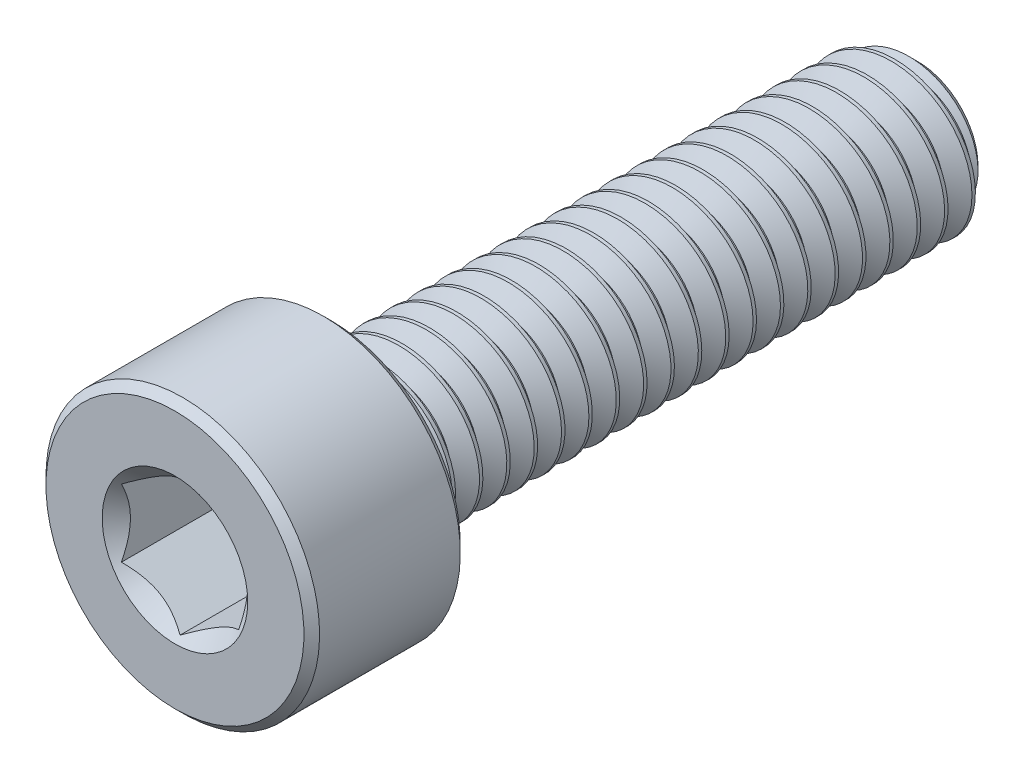
from build123d import *

# Parameters (mm, degrees)
CUT_EXTRUDE1_DEPTH     = 3
SPLIT1_SURFACE_1_BACK  = 22.424
SPLIT1_SURFACE_1_DEPTH = 44.848
SPLIT1_SURFACE_2_BACK  = 22.424
SPLIT1_SURFACE_2_DEPTH = 44.848
CUT_SWEEP1_PITCH       = 0.7


with BuildPart() as part:
    # Sketch2 → Revolve1 (revolve)
    with BuildSketch(Plane(origin=(0, 0, 0), x_dir=(0, 0, -1), z_dir=(1, 0, 0))):
        with BuildLine():
            Line((-9.5, 0), (-9.5, 3.3))
            Line((-9.5, 3.3), (-9.3, 3.5))
            Line((-9.3, 3.5), (-5.7, 3.5))
            Line((-5.7, 3.5), (-5.5, 3.3))
            Line((-5.5, 3.3), (-5.5, 2.2))
            ThreePointArc((-5.5, 2.2), (-5.441421356, 2.058578644), (-5.3, 2))
            Line((-5.3, 2), (9.045336663, 2))
            Line((9.045336663, 2), (9.5, 1.545336663))
            Line((9.5, 1.545336663), (9.5, 0))
            Line((9.5, 0), (-9.5, 0))
        make_face()
    revolve(axis=Axis((0, 0, -9.5), (0, 0, 1)))

    # Sketch3 → Cut-Extrude1 (cut)
    with BuildSketch(Plane.XY.offset(9.5)):
        Polygon((1.5, -0.866025404), (1.5, 0.866025404), (0, 1.732050808), (-1.5, 0.866025404), (-1.5, -0.866025404), (0, -1.732050808), align=None)
    extrude(amount=-CUT_EXTRUDE1_DEPTH, mode=Mode.SUBTRACT)

    # Cut-Extrude2 cone 1 section (through the dimple's axis) → Cut-Extrude2 (revolve, cut)
    with BuildSketch(Plane(origin=(0, 0, 9.5), x_dir=(0, -1, 0), z_dir=(1, 0, 0))):
        Polygon((0, 0), (1.861954618, 0), (0, 1.861954618), align=None)
    revolve(axis=Axis((0, 0, 9.5), (0, 0, -1)), mode=Mode.SUBTRACT)


with BuildPart() as body_2:
    # Split1: the piece behind the surface
    add(part.part)
    # Split1 surface: a surface, the sketch's curves swept straight by 44.848 mm
    with BuildLine(Plane(origin=(0, 0, 0), x_dir=(0, 0, -1), z_dir=(1, 0, 0)).offset(-SPLIT1_SURFACE_1_BACK), mode=Mode.PRIVATE) as split1_surface_1_path:
        Line((-5.3, -3.5), (-5.3, 3.5))
    split1_surface_1 = Shell.extrude(split1_surface_1_path.wire(), (1 * SPLIT1_SURFACE_1_DEPTH, 0 * SPLIT1_SURFACE_1_DEPTH, 0 * SPLIT1_SURFACE_1_DEPTH))
    split(bisect_by=split1_surface_1, keep=Keep.BOTTOM)

    # Cut-Sweep1: the profile of Sketch7 screwed along a right-hand helix of 22.428571 turns, 6 arcs to a turn; built about Z, then put on its axis
    cut_sweep1_z = Axis((0, 0, 0), (0, 0, 1))
    cut_sweep1_corners = [(2.037888611, 0, 0.021875), (2.037888611, 0, -0.634375), (1.545336663, 0, -0.35), (1.545336663, 0, -0.2625)]
    with BuildLine(mode=Mode.PRIVATE) as cut_sweep1_profile:
        Line(cut_sweep1_corners[0], cut_sweep1_corners[1])
        Line(cut_sweep1_corners[1], cut_sweep1_corners[2])
        Line(cut_sweep1_corners[2], cut_sweep1_corners[3])
        Line(cut_sweep1_corners[3], cut_sweep1_corners[0])
    cut_sweep1_cap = Face(cut_sweep1_profile.wire())
    cut_sweep1_turn_angles = [0, 30, 60, 90, 120, 150, 180, 210, 240, 270, 300, 330, 360]
    cut_sweep1_turn_weights = [1, 0.8660254037844387, 1, 0.8660254037844387, 1, 0.8660254037844387, 1, 0.8660254037844387, 1, 0.8660254037844387, 1, 0.8660254037844387, 1]
    cut_sweep1_turn_rails = [Edge.make_bspline([Vector(p[0], p[1], 0).rotate(cut_sweep1_z, cut_sweep1_turn_angles[k]) / cut_sweep1_turn_weights[k] + Vector(0, 0, p[2] + CUT_SWEEP1_PITCH * cut_sweep1_turn_angles[k] / 360) for k in range(13)], [0, 0, 0, 1, 1, 2, 2, 3, 3, 4, 4, 5, 5, 6, 6, 6], 2, cut_sweep1_turn_weights) for p in cut_sweep1_corners]
    cut_sweep1_turn_sides = [Face.make_surface_from_curves(cut_sweep1_turn_rails[p[0]], cut_sweep1_turn_rails[p[1]]) for p in [(0, 1), (1, 2), (2, 3), (3, 0)]]
    cut_sweep1_last_angles = [7920, 7950, 7980, 8010, 8040, 8057.142857143, 8074.285714286]
    cut_sweep1_last_weights = [1, 0.8660254037844387, 1, 0.8660254037844387, 1, 0.9555728057859783, 1]
    cut_sweep1_last_rails = [Edge.make_bspline([Vector(p[0], p[1], 0).rotate(cut_sweep1_z, cut_sweep1_last_angles[k]) / cut_sweep1_last_weights[k] + Vector(0, 0, p[2] + CUT_SWEEP1_PITCH * cut_sweep1_last_angles[k] / 360) for k in range(7)], [0, 0, 0, 1, 1, 2, 2, 3, 3, 3], 2, cut_sweep1_last_weights) for p in cut_sweep1_corners]
    cut_sweep1_last_sides = [Face.make_surface_from_curves(cut_sweep1_last_rails[p[0]], cut_sweep1_last_rails[p[1]]) for p in [(0, 1), (1, 2), (2, 3), (3, 0)]]
    cut_sweep1 = Plane(origin=(0, 0, -9.5), x_dir=(0, 1, 0), z_dir=(0, 0, 1)) * Solid(Shell([*[p.moved(Location((0, 0, CUT_SWEEP1_PITCH * i))) for i in range(22) for p in cut_sweep1_turn_sides], *cut_sweep1_last_sides, cut_sweep1_cap, cut_sweep1_cap.rotate(cut_sweep1_z, 8074.285714286).moved(Location((0, 0, CUT_SWEEP1_PITCH * 8074.285714286 / 360)))]))
    add(cut_sweep1, mode=Mode.SUBTRACT)


with BuildPart() as part_1:
    add(part.part)

    # Split1: split by a surface, the side it looks to stays
    # Split1 surface: a surface, the sketch's curves swept straight by 44.848 mm
    with BuildLine(Plane(origin=(0, 0, 0), x_dir=(0, 0, -1), z_dir=(1, 0, 0)).offset(-SPLIT1_SURFACE_2_BACK), mode=Mode.PRIVATE) as split1_surface_2_path:
        Line((-5.3, -3.5), (-5.3, 3.5))
    split1_surface_2 = Shell.extrude(split1_surface_2_path.wire(), (1 * SPLIT1_SURFACE_2_DEPTH, 0 * SPLIT1_SURFACE_2_DEPTH, 0 * SPLIT1_SURFACE_2_DEPTH))
    split(bisect_by=split1_surface_2, keep=Keep.TOP)

    add(body_2.part)  # Revolve2 merges body 2
    # Sketch8 → Revolve2 (revolve)
    with BuildSketch(Plane(origin=(0, 0, 0), x_dir=(0, 0, -1), z_dir=(1, 0, 0)), mode=Mode.PRIVATE) as revolve2_sk:
        Polygon((-5.5, 0), (-5.5, 2), (-5.3, 2), (-4.145299462, 0), align=None)
    revolve(revolve2_sk.sketch.rotate(Axis((0, 0, 4.145299462), (0, 0, 1)), 270), axis=Axis((0, 0, 4.145299462), (0, 0, 1)))


solid = part_1.part
